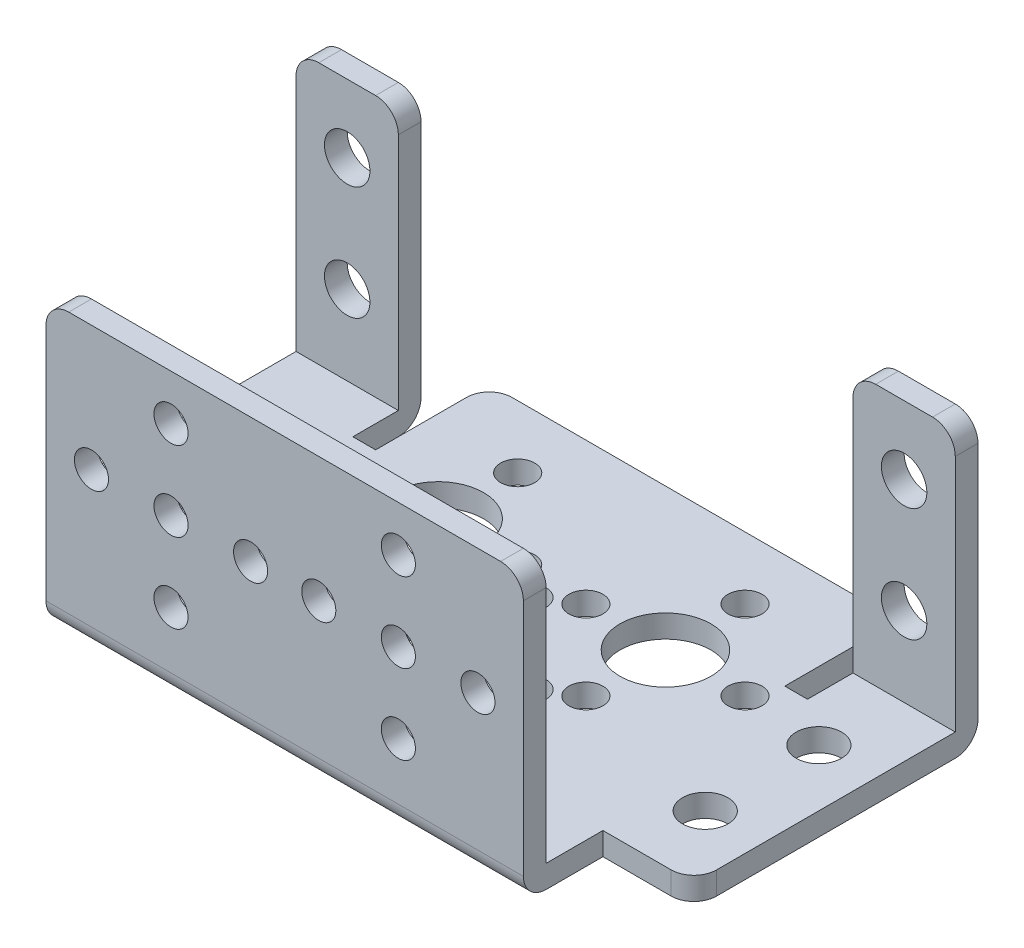
from build123d import *

# Parameters (mm, degrees)
SKETCH1_W           = 42
SKETCH1_H           = 25
SKETCH1_R           = 1.5
BOSS_EXTRUDE1_DEPTH = 2
SKETCH2_R           = 2
SKETCH2_R_2         = 4
SKETCH2_R_3         = 1.5
BOSS_EXTRUDE2_DEPTH = 2
CUT_EXTRUDE1_DEPTH  = 2
FILLET1_R           = 2
FILLET2_R           = 2
FILLET3_R           = 2
FILLET4_R           = 2
FILLET5_R           = 2
BOSS_EXTRUDE3_DEPTH = 2
FILLET6_R           = 2
FILLET7_R           = 2
SKETCH5_R           = 2
CUT_EXTRUDE2_DEPTH  = 2


with BuildPart() as part:
    # Sketch1 → Boss-Extrude1 (new body)
    with BuildSketch(Plane.XY):
        with Locations((21, 12.5)):
            Rectangle(SKETCH1_W, SKETCH1_H)
        with Locations((11, 14)):
            Circle(SKETCH1_R, mode=Mode.SUBTRACT)
        with Locations((11, 21)):
            Circle(SKETCH1_R, mode=Mode.SUBTRACT)
        with Locations((18, 14)):
            Circle(SKETCH1_R, mode=Mode.SUBTRACT)
        with Locations((4, 14)):
            Circle(SKETCH1_R, mode=Mode.SUBTRACT)
        with Locations((11, 7)):
            Circle(SKETCH1_R, mode=Mode.SUBTRACT)
        with Locations((31, 14)):
            Circle(SKETCH1_R, mode=Mode.SUBTRACT)
        with Locations((38, 14)):
            Circle(SKETCH1_R, mode=Mode.SUBTRACT)
        with Locations((31, 21)):
            Circle(SKETCH1_R, mode=Mode.SUBTRACT)
        with Locations((24, 14)):
            Circle(SKETCH1_R, mode=Mode.SUBTRACT)
        with Locations((31, 7)):
            Circle(SKETCH1_R, mode=Mode.SUBTRACT)
    extrude(amount=-BOSS_EXTRUDE1_DEPTH)

    # Sketch2 → Boss-Extrude2 (add)
    with BuildSketch(Plane.XZ):
        with BuildLine():
            Line((0, -32), (0, -36))
            Line((0, -36), (42, -36))
            Line((42, -36), (42, -32))
            Line((42, -32), (50, -32))
            Line((50, -32), (50, -9))
            ThreePointArc((50, -9), (49.414213562, -7.585786438), (48, -7))
            Line((48, -7), (42, -7))
            Line((42, -7), (42, 0))
            Line((42, 0), (0, 0))
            Line((0, 0), (0, -7))
            Line((0, -7), (-6, -7))
            ThreePointArc((-6, -7), (-7.414213562, -7.585786438), (-8, -9))
            Line((-8, -9), (-8, -32))
            Line((-8, -32), (0, -32))
        make_face()
        with Locations((45, -13)):
            Circle(SKETCH2_R, mode=Mode.SUBTRACT)
        with Locations((45, -23)):
            Circle(SKETCH2_R, mode=Mode.SUBTRACT)
        with Locations((-3, -13)):
            Circle(SKETCH2_R, mode=Mode.SUBTRACT)
        with Locations((-3, -23)):
            Circle(SKETCH2_R, mode=Mode.SUBTRACT)
        with Locations((11, -23.5)):
            Circle(SKETCH2_R_2, mode=Mode.SUBTRACT)
        with Locations((31, -23.5)):
            Circle(SKETCH2_R_2, mode=Mode.SUBTRACT)
        with Locations((21, -14.5)):
            Circle(SKETCH2_R_2, mode=Mode.SUBTRACT)
        with Locations((11, -16.5)):
            Circle(SKETCH2_R_3, mode=Mode.SUBTRACT)
        with Locations((11, -30.5)):
            Circle(SKETCH2_R_3, mode=Mode.SUBTRACT)
        with Locations((18, -23.5)):
            Circle(SKETCH2_R_3, mode=Mode.SUBTRACT)
        with Locations((4, -23.5)):
            Circle(SKETCH2_R_3, mode=Mode.SUBTRACT)
        with Locations((31, -30.5)):
            Circle(SKETCH2_R_3, mode=Mode.SUBTRACT)
        with Locations((24, -23.5)):
            Circle(SKETCH2_R_3, mode=Mode.SUBTRACT)
        with Locations((31, -16.5)):
            Circle(SKETCH2_R_3, mode=Mode.SUBTRACT)
        with Locations((38, -23.5)):
            Circle(SKETCH2_R_3, mode=Mode.SUBTRACT)
        with Locations((21, -21.5)):
            Circle(SKETCH2_R_3, mode=Mode.SUBTRACT)
        with Locations((21, -7.5)):
            Circle(SKETCH2_R_3, mode=Mode.SUBTRACT)
        with Locations((28, -14.5)):
            Circle(SKETCH2_R_3, mode=Mode.SUBTRACT)
        with Locations((14, -14.5)):
            Circle(SKETCH2_R_3, mode=Mode.SUBTRACT)
    extrude(amount=-BOSS_EXTRUDE2_DEPTH)

    # Sketch3 → Cut-Extrude1 (cut)
    with BuildSketch(Plane.XZ):
        Polygon((39, -36), (39, -26), (41, -26), (41, -32), (42, -32), (42, -36), align=None)
    cut_extrude1 = extrude(amount=-CUT_EXTRUDE1_DEPTH, mode=Mode.SUBTRACT)

    # Mirror1: Cut-Extrude1 across plane
    add(cut_extrude1.mirror(Plane(origin=(21, 0, 0), x_dir=(0, 0, 1), z_dir=(1, 0, 0))), mode=Mode.SUBTRACT)

    # Fillet1
    fillet1_edges = [part.edges().sort_by_distance(p)[0] for p in [
        (3, 1, -36),
    ]]
    fillet(fillet1_edges, radius=FILLET1_R)

    # Fillet2
    fillet2_edges = [part.edges().sort_by_distance(p)[0] for p in [
        (39, 1, -36),
    ]]
    fillet(fillet2_edges, radius=FILLET2_R)

    # Fillet3
    fillet3_edges = [part.edges().sort_by_distance(p)[0] for p in [
        (21, 0, 0),
    ]]
    fillet(fillet3_edges, radius=FILLET3_R)

    # Fillet4
    fillet4_edges = [part.edges().sort_by_distance(p)[0] for p in [
        (42, 25, -1),
    ]]
    fillet(fillet4_edges, radius=FILLET4_R)

    # Fillet5
    fillet5_edges = [part.edges().sort_by_distance(p)[0] for p in [
        (0, 25, -1),
    ]]
    fillet(fillet5_edges, radius=FILLET5_R)

    # Sketch4 → Boss-Extrude3 (add)
    with BuildSketch(Plane(origin=(0, 0, -32), x_dir=(-1, 0, 0), z_dir=(0, 0, -1))):
        with BuildLine():
            Line((8, 0), (-1, 0))
            Line((-1, 0), (-1, 23))
            ThreePointArc((-1, 23), (-0.414213562, 24.414213562), (1, 25))
            Line((1, 25), (6, 25))
            ThreePointArc((6, 25), (7.414213562, 24.414213562), (8, 23))
            Line((8, 23), (8, 0))
        make_face()
    boss_extrude3 = extrude(amount=-BOSS_EXTRUDE3_DEPTH)

    # Mirror2: Boss-Extrude3 across plane
    add(boss_extrude3.mirror(Plane(origin=(21, 0, 0), x_dir=(0, 0, 1), z_dir=(1, 0, 0))))

    # Fillet6
    fillet6_edges = [part.edges().sort_by_distance(p)[0] for p in [
        (45.5, 0, -32),
    ]]
    fillet(fillet6_edges, radius=FILLET6_R)

    # Fillet7
    fillet7_edges = [part.edges().sort_by_distance(p)[0] for p in [
        (-3.5, 0, -32),
    ]]
    fillet(fillet7_edges, radius=FILLET7_R)

    # Sketch5 → Cut-Extrude2 (cut)
    with BuildSketch(Plane(origin=(0, 0, -32), x_dir=(-1, 0, 0), z_dir=(0, 0, -1))):
        with Locations((3.5, 19)):
            Circle(SKETCH5_R)
        with Locations((3.5, 9)):
            Circle(SKETCH5_R)
    cut_extrude2 = extrude(amount=-CUT_EXTRUDE2_DEPTH, mode=Mode.SUBTRACT)

    # Mirror3: Cut-Extrude2 across plane
    add(cut_extrude2.mirror(Plane(origin=(21, 0, 0), x_dir=(0, 0, 1), z_dir=(1, 0, 0))), mode=Mode.SUBTRACT)


solid = part.part
